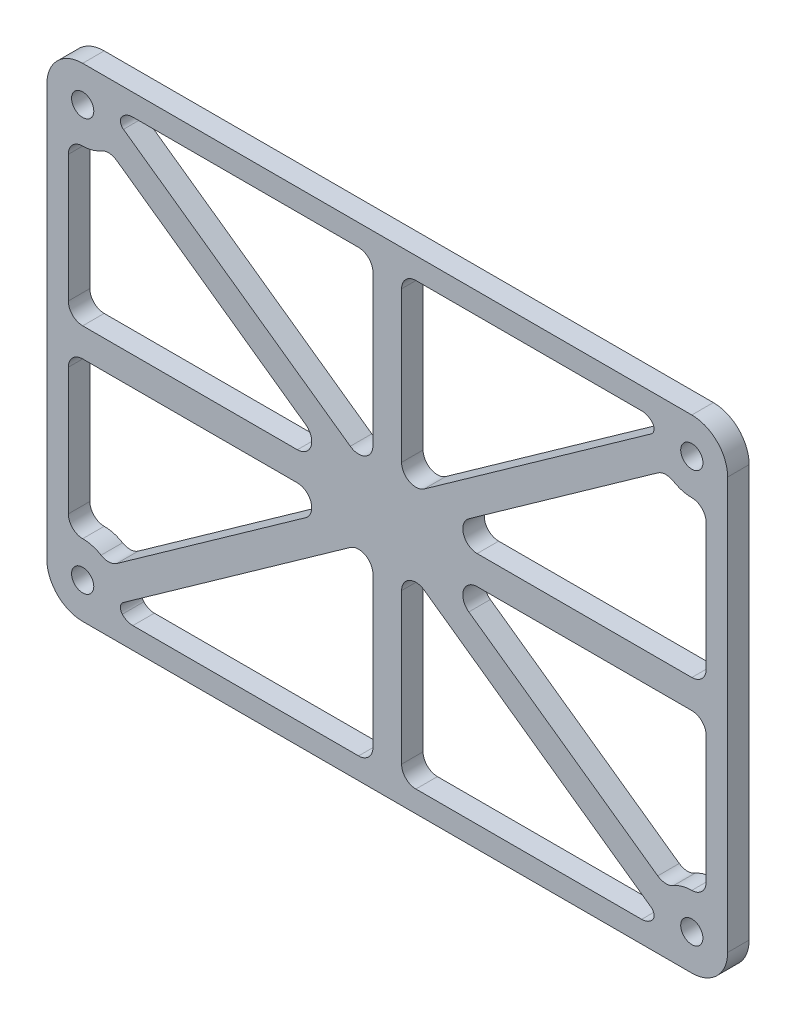
from build123d import *

# Parameters (mm, degrees)
SKETCH_1_R      = 5
SKETCH_1_R_2    = 1.55
EXTRUDE_1_DEPTH = 3
FILLET_1_R      = 2
FILLET_2_R      = 1


with BuildPart() as part:
    # 草图1 → 凸台-拉伸1 (new body)
    # profile 1 of 5: a face of its own
    with BuildSketch(Plane.XY):
        with BuildLine():
            Line((-42.5, -33.725), (42.5, -33.725))
            ThreePointArc((42.5, -33.725), (39.761387212, -32.908300133), (37.917424305, -30.725))
            Line((37.917424305, -30.725), (2, -30.725))
            Line((2, -30.725), (2, -3.872835094))
            Line((2, -3.872835094), (37.513133211, -29.087159674))
            ThreePointArc((37.513133211, -29.087159674), (37.811061724, -26.988953387), (38.951354438, -25.202626557))
            Line((38.951354438, -25.202626557), (6.271598724, -2))
            Line((6.271598724, -2), (44.5, -2))
            Line((44.5, -2), (44.5, -24.142424305))
            ThreePointArc((44.5, -24.142424305), (46.683300133, -25.986387212), (47.5, -28.725))
            Line((47.5, -28.725), (47.5, 28.725))
            ThreePointArc((47.5, 28.725), (46.683300133, 25.986387212), (44.5, 24.142424305))
            Line((44.5, 24.142424305), (44.5, 2))
            Line((44.5, 2), (6.271598724, 2))
            Line((6.271598724, 2), (38.951354438, 25.202626557))
            ThreePointArc((38.951354438, 25.202626557), (37.811061724, 26.988953387), (37.513133211, 29.087159674))
            Line((37.513133211, 29.087159674), (2, 3.872835094))
            Line((2, 3.872835094), (2, 30.725))
            Line((2, 30.725), (37.917424305, 30.725))
            ThreePointArc((37.917424305, 30.725), (39.761387212, 32.908300133), (42.5, 33.725))
            Line((42.5, 33.725), (-42.5, 33.725))
            ThreePointArc((-42.5, 33.725), (-39.761387212, 32.908300133), (-37.917424305, 30.725))
            Line((-37.917424305, 30.725), (-2, 30.725))
            Line((-2, 30.725), (-2, 3.872835094))
            Line((-2, 3.872835094), (-37.513133211, 29.087159674))
            ThreePointArc((-37.513133211, 29.087159674), (-37.503284381, 28.906198862), (-37.5, 28.725))
            ThreePointArc((-37.5, 28.725), (-37.87705571, 26.820167699), (-38.951354438, 25.202626557))
            Line((-38.951354438, 25.202626557), (-6.271598724, 2))
            Line((-6.271598724, 2), (-44.5, 2))
            Line((-44.5, 2), (-44.5, 24.142424305))
            ThreePointArc((-44.5, 24.142424305), (-46.683300133, 25.986387212), (-47.5, 28.725))
            Line((-47.5, 28.725), (-47.5, -28.725))
            ThreePointArc((-47.5, -28.725), (-46.683300133, -25.986387212), (-44.5, -24.142424305))
            Line((-44.5, -24.142424305), (-44.5, -2))
            Line((-44.5, -2), (-6.271598724, -2))
            Line((-6.271598724, -2), (-38.951354438, -25.202626557))
            ThreePointArc((-38.951354438, -25.202626557), (-37.87705571, -26.820167699), (-37.5, -28.725))
            ThreePointArc((-37.5, -28.725), (-37.503284381, -28.906198862), (-37.513133211, -29.087159674))
            Line((-37.513133211, -29.087159674), (-2, -3.872835094))
            Line((-2, -3.872835094), (-2, -30.725))
            Line((-2, -30.725), (-37.917424305, -30.725))
            ThreePointArc((-37.917424305, -30.725), (-39.761387212, -32.908300133), (-42.5, -33.725))
        make_face()
    # profile 2 of 5: a face of its own
    with BuildSketch(Plane.XY):
        with Locations((-42.5, 28.725)):
            Circle(SKETCH_1_R)
        with Locations((-42.5, 28.725)):
            Circle(SKETCH_1_R_2, mode=Mode.SUBTRACT)
    # profile 3 of 5: a face of its own
    with BuildSketch(Plane.XY):
        with Locations((42.5, 28.725)):
            Circle(SKETCH_1_R)
        with Locations((42.5, 28.725)):
            Circle(SKETCH_1_R_2, mode=Mode.SUBTRACT)
    # profile 4 of 5: a face of its own
    with BuildSketch(Plane.XY):
        with Locations((42.5, -28.725)):
            Circle(SKETCH_1_R)
        with Locations((42.5, -28.725)):
            Circle(SKETCH_1_R_2, mode=Mode.SUBTRACT)
    # profile 5 of 5: a face of its own
    with BuildSketch(Plane.XY):
        with Locations((-42.5, -28.725)):
            Circle(SKETCH_1_R)
        with Locations((-42.5, -28.725)):
            Circle(SKETCH_1_R_2, mode=Mode.SUBTRACT)
    extrude(amount=EXTRUDE_1_DEPTH)

    # 圆角1
    # the kernel refuses this fillet: 2 mm, written as the material it adds along each edge
    with BuildSketch(Plane(origin=(38.951354438, 25.202626557, 0), x_dir=(-0.8153829846202765, -0.5789219190803973, 0), z_dir=(0, 0, 1)), Plane(origin=(-38.951354438, -25.202626557, 0), x_dir=(0.8153829846202759, 0.5789219190803978, 0), z_dir=(0, 0, 1))) as fillet_1_piece_1:
        with BuildLine():
            CenterArc((1.475169897, 2), FILLET_1_R, 203.736299512, 66.263700488)
            ThreePointArc((-0.355645617, 1.194944379), (-0.140432135, 0.608600598), (0, 0))
            Line((0, 0), (1.475169897, 0))
        make_face()
    extrude(amount=3)
    with BuildSketch(Plane(origin=(6.271598724, 2, 0), x_dir=(1, 0, 0), z_dir=(0, 0, 1)), Plane(origin=(6.271598724, -2, 0), x_dir=(0.8153829846202769, -0.5789219190803966, 0), z_dir=(0, 0, 1)), Plane(origin=(-6.271598724, -2, 0), x_dir=(-1, 0, 0), z_dir=(0, 0, 1)), Plane(origin=(-6.271598724, 2, 0), x_dir=(-0.8153829846202769, 0.5789219190803967, 0), z_dir=(0, 0, 1))) as fillet_1_piece_2:
        with BuildLine():
            CenterArc((FILLET_1_R * 3.13579936221, FILLET_1_R), FILLET_1_R, 125.374751844, 144.625248156)
            Line((FILLET_1_R * 2.55687744313, FILLET_1_R * 1.81538298462), (0, 0))
            Line((0, 0), (FILLET_1_R * 3.13579936221, 0))
        make_face()
    extrude(amount=3)
    with BuildSketch(Plane(origin=(44.5, 2, 0), x_dir=(0, 1, 0), z_dir=(0, 0, 1)), Plane(origin=(44.5, -2, 0), x_dir=(-1, 0, 0), z_dir=(0, 0, 1)), Plane(origin=(2, -30.725, 0), x_dir=(1, 0, 0), z_dir=(0, 0, 1)), Plane(origin=(-2, -30.725, 0), x_dir=(0, 1, 0), z_dir=(0, 0, 1)), Plane(origin=(-44.5, -2, 0), x_dir=(0, -1, 0), z_dir=(0, 0, 1)), Plane(origin=(-44.5, 2, 0), x_dir=(1, 0, 0), z_dir=(0, 0, 1)), Plane(origin=(-2, 30.725, 0), x_dir=(-1, 0, 0), z_dir=(0, 0, 1)), Plane(origin=(2, 30.725, 0), x_dir=(0, -1, 0), z_dir=(0, 0, 1))) as fillet_1_piece_3:
        with BuildLine():
            CenterArc((FILLET_1_R, FILLET_1_R), FILLET_1_R, 180, 90)
            Line((0, FILLET_1_R), (0, 0))
            Line((0, 0), (FILLET_1_R, 0))
        make_face()
    extrude(amount=3)
    with BuildSketch(Plane(origin=(44.5, 24.142424305, 0), x_dir=(0, -1, 0), z_dir=(0, 0, 1)), Plane(origin=(37.917424305, -30.725, 0), x_dir=(-1, 0, 0), z_dir=(0, 0, 1)), Plane(origin=(-44.5, -24.142424305, 0), x_dir=(0, 1, 0), z_dir=(0, 0, 1)), Plane(origin=(-37.917424305, 30.725, 0), x_dir=(1, 0, 0), z_dir=(0, 0, 1))) as fillet_1_piece_4:
        with BuildLine():
            CenterArc((2.417424305, -2), FILLET_1_R, 90, 90)
            ThreePointArc((0.417424305, -2), (0.31195587, -0.978451782), (0, 0))
            Line((0, 0), (2.417424305, 0))
        make_face()
    extrude(amount=3)
    with BuildSketch(Plane(origin=(44.5, -24.142424305, 0), x_dir=(0, 1, 0), z_dir=(0, 0, 1)), Plane(origin=(-37.917424305, -30.725, 0), x_dir=(1, 0, 0), z_dir=(0, 0, 1)), Plane(origin=(-44.5, 24.142424305, 0), x_dir=(0, -1, 0), z_dir=(0, 0, 1)), Plane(origin=(37.917424305, 30.725, 0), x_dir=(-1, 0, 0), z_dir=(0, 0, 1))) as fillet_1_piece_5:
        with BuildLine():
            CenterArc((2.417424305, 2), FILLET_1_R, 180, 90)
            ThreePointArc((0.417424305, 2), (0.31195587, 0.978451782), (0, 0))
            Line((0, 0), (2.417424305, 0))
        make_face()
    extrude(amount=3)
    with BuildSketch(Plane(origin=(38.951354438, -25.202626557, 0), x_dir=(-0.8153829846202785, 0.5789219190803946, 0), z_dir=(0, 0, 1)), Plane(origin=(-38.951354438, 25.202626557, 0), x_dir=(0.8153829846202768, -0.5789219190803968, 0), z_dir=(0, 0, 1))) as fillet_1_piece_6:
        with BuildLine():
            CenterArc((1.475169897, -2), FILLET_1_R, 90, 66.263700488)
            ThreePointArc((-0.355645617, -1.194944379), (-0.140432135, -0.608600598), (0, 0))
            Line((0, 0), (1.475169897, 0))
        make_face()
    extrude(amount=3)
    with BuildSketch(Plane(origin=(2, -3.872835094, 0), x_dir=(0, -1, 0), z_dir=(0, 0, 1)), Plane(origin=(-2, -3.872835094, 0), x_dir=(-0.8153829846202767, -0.5789219190803968, 0), z_dir=(0, 0, 1)), Plane(origin=(-2, 3.872835094, 0), x_dir=(0, 1, 0), z_dir=(0, 0, 1)), Plane(origin=(2, 3.872835094, 0), x_dir=(0.8153829846202766, 0.578921919080397, 0), z_dir=(0, 0, 1))) as fillet_1_piece_7:
        with BuildLine():
            CenterArc((FILLET_1_R * 1.93641754717, FILLET_1_R), FILLET_1_R, 144.625248156, 125.374751844)
            Line((FILLET_1_R * 1.12103456255, FILLET_1_R * 1.57892191908), (0, 0))
            Line((0, 0), (FILLET_1_R * 1.93641754717, 0))
        make_face()
    extrude(amount=3)
    with BuildSketch(Plane(origin=(37.513133211, -29.087159674, 0), x_dir=(-0.8153829846202749, 0.5789219190803994, 0), z_dir=(0, 0, 1)), Plane(origin=(-37.513133211, 29.087159674, 0), x_dir=(0.8153829846202781, -0.5789219190803949, 0), z_dir=(0, 0, 1))) as fillet_1_piece_8:
        with BuildLine():
            CenterArc((0.849166367, 2), FILLET_1_R, 227.759477208, 42.240522792)
            ThreePointArc((-0.495322353, 0.519341335), (-0.23833117, 0.268569172), (0, 0))
            Line((0, 0), (0.849166367, 0))
        make_face()
    extrude(amount=3)
    with BuildSketch(Plane(origin=(-37.513133211, -29.087159674, 0), x_dir=(0.8153829846202739, 0.5789219190804008, 0), z_dir=(0, 0, 1)), Plane(origin=(37.513133211, 29.087159674, 0), x_dir=(-0.8153829846202756, -0.5789219190803985, 0), z_dir=(0, 0, 1))) as fillet_1_piece_9:
        with BuildLine():
            CenterArc((0.849166367, -2), FILLET_1_R, 90, 42.240522792)
            ThreePointArc((-0.495322353, -0.519341335), (-0.23833117, -0.268569172), (0, 0))
            Line((0, 0), (0.849166367, 0))
        make_face()
    extrude(amount=3)

    # 圆角2
    fillet_2_edges = [part.edges().sort_by_distance(p)[0] for p in [
        (-37.422632563, 29.275893843, 1.5),
        (-37.422632563, -29.275893843, 1.5),
        (37.422632563, -29.275893843, 1.5),
        (37.422632563, 29.275893843, 1.5),
    ]]
    fillet(fillet_2_edges, radius=FILLET_2_R)


solid = part.part
